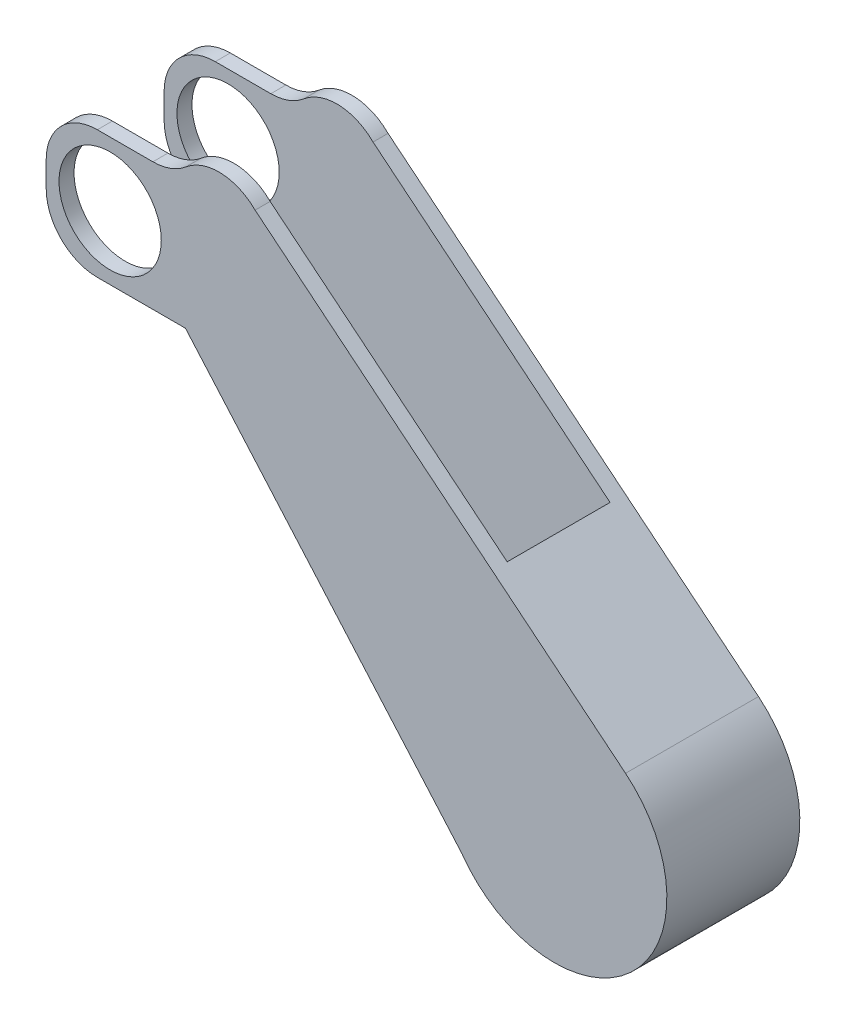
from build123d import *

# Parameters (mm, degrees)
EXTRUDE_1_DEPTH      = 26
SKETCH_4_R           = 9.996910884
CUT_EXTRUDE_2_DEPTH  = 26
FILLET_1_R           = 10
FILLET_2_R           = 10
CUT_EXTRUDE_4_DEPTH  = 26
SKETCH_8_R           = 13.6
CUT_EXTRUDE_5_DEPTH  = 20.12
EXTRUDE_2_DEPTH      = 26
FILLET_3_R           = 3
CUT_EXTRUDE_6_DEPTH  = 30
FILLET_9_R           = 10
FILLET_10_R          = 3
FILLET_11_R          = 10
CUT_EXTRUDE_7_DEPTH  = 30
SKETCH_13_W          = 20.118493956
SKETCH_13_H          = 70
CUT_EXTRUDE_8_DEPTH  = 44.75
CUT_EXTRUDE_9_DEPTH  = 44.75
SKETCH_15_R          = 22
EXTRUDE_3_DEPTH      = 26
EXTRUDE_4_REACH      = 99.657
CUT_EXTRUDE_13_DEPTH = 20
EXTRUDE_START        = -2.941506044
EXTRUDE_5_DEPTH      = 2.941506044
EXTRUDE_6_DEPTH      = 2.94


with BuildPart() as part:
    # 草图1 → 凸台-拉伸1 (new body)
    with BuildSketch(Plane.XY):
        Polygon((0, 0), (60.004097951, 0), (60.004097951, 25.002996284), (-59.998288516, 25.002996284), (-59.998288516, 0), align=None)
    extrude(amount=EXTRUDE_1_DEPTH)

    # 草图4 → 切除-拉伸2 (cut)
    with BuildSketch(Plane.XY.offset(26)):
        with Locations((-47.497668288, 12.501498142)):
            Circle(SKETCH_4_R)
    extrude(amount=-CUT_EXTRUDE_2_DEPTH, mode=Mode.SUBTRACT)

    # 圆角1
    fillet_1_edges = [part.edges().sort_by_distance(p)[0] for p in [
        (-59.998288516, 25.002996284, 13),
    ]]
    fillet(fillet_1_edges, radius=FILLET_1_R)

    # 圆角2
    fillet_2_edges = [part.edges().sort_by_distance(p)[0] for p in [
        (-59.998288516, 0, 13),
    ]]
    fillet(fillet_2_edges, radius=FILLET_2_R)

    # 草图7 → 切除-拉伸4 (cut)
    with BuildSketch(Plane(origin=(0, 25.002996284, 0), x_dir=(1, 0, 0), z_dir=(0, 1, 0))):
        Polygon((-37.501471928, -23.058493956), (-36.401101967, -23.058493956), (-36.401101967, -2.94), (-37.501471928, -2.94), (-62.053584156, -2.94), (-62.053584156, -23.058493956), align=None)
    extrude(amount=-CUT_EXTRUDE_4_DEPTH, mode=Mode.SUBTRACT)

    # 草图8 → 切除-拉伸5 (cut)
    with BuildSketch(Plane.XY.offset(2.94)):
        with Locations((-47.497668288, 12.501498142)):
            Circle(SKETCH_8_R)
    extrude(amount=CUT_EXTRUDE_5_DEPTH, mode=Mode.SUBTRACT)

    # 草图9 → 凸台-拉伸2 (add)
    with BuildSketch(Plane.XY.offset(26)):
        Polygon((-34.9988745, 25.002996284), (-22.500080712, 12.501498142), (-27.68722448, 0), (39.366276038, -67.053500518), (48.202948014, -58.216828542), (57.0397416, -49.380034956), (-17.34328964, 25.002996284), (-26.17108207, 33.830788714), align=None)
    extrude(amount=-EXTRUDE_2_DEPTH)

    # 圆角3
    fillet_3_edges = [part.edges().sort_by_distance(p)[0] for p in [
        (-36.401101967, 0, 12.999246978),
        (-36.401101967, 20.36446297, 12.999246978),
        (-36.401101967, 4.638533314, 12.999246978),
    ]]
    fillet(fillet_3_edges, radius=FILLET_3_R)

    # 草图10 → 切除-拉伸6 (cut)
    with BuildSketch(Plane.XY.offset(26)):
        Polygon((7.659706645, 0), (60.004097951, 0), (60.004097951, 25.002996284), (-17.34328964, 25.002996284), align=None)
    extrude(amount=-CUT_EXTRUDE_6_DEPTH, mode=Mode.SUBTRACT)

    # 圆角9
    # the kernel refuses this fillet: 10 mm, written as the material it adds along each edge
    with BuildSketch(Plane(origin=(-34.9988745, 25.002996284, 26), x_dir=(-1, 0, 0), z_dir=(0, 0, -1))) as fillet_9_piece_1_section:
        with BuildLine():
            CenterArc((FILLET_9_R * 0.414213562373, FILLET_9_R), FILLET_9_R, 225, 45)
            Line((-FILLET_9_R * 0.292893218813, FILLET_9_R * 0.292893218813), (0, 0))
            Line((0, 0), (FILLET_9_R * 0.414213562373, 0))
        make_face()
    fillet_9_piece_1 = extrude(amount=26, mode=Mode.PRIVATE)
    fillet_9_piece_1 = split(fillet_9_piece_1, bisect_by=Plane(origin=(-36.401101967, 24.986097048, 24.529246978), z_dir=(-1, 0, 0)), keep=Keep.TOP, mode=Mode.PRIVATE)
    fillet_9_piece_1 = split(fillet_9_piece_1, bisect_by=Plane(origin=(-37.504554949, 24.986097048, 23.058493956), z_dir=(0, 0, 1)), keep=Keep.TOP, mode=Mode.PRIVATE)
    add(fillet_9_piece_1)
    with BuildSketch(Plane(origin=(-34.9988745, 25.002996284, 26), x_dir=(-1, 0, 0), z_dir=(0, 0, -1))) as fillet_9_piece_2_section:
        with BuildLine():
            CenterArc((FILLET_9_R * 0.414213562373, FILLET_9_R), FILLET_9_R, 225, 45)
            Line((-FILLET_9_R * 0.292893218813, FILLET_9_R * 0.292893218813), (0, 0))
            Line((0, 0), (FILLET_9_R * 0.414213562373, 0))
        make_face()
    fillet_9_piece_2 = extrude(amount=26, mode=Mode.PRIVATE)
    fillet_9_piece_2 = split(fillet_9_piece_2, bisect_by=Plane(origin=(-36.401101967, 25.815006688, 24.529246978), z_dir=(1, 0, 0)), keep=Keep.TOP, mode=Mode.PRIVATE)
    fillet_9_piece_2 = split(fillet_9_piece_2, bisect_by=Plane(origin=(-34.567927652, 25.815006688, 23.058493956), z_dir=(0, 0, 1)), keep=Keep.TOP, mode=Mode.PRIVATE)
    add(fillet_9_piece_2)
    with BuildSketch(Plane(origin=(-34.9988745, 25.002996284, 26), x_dir=(-1, 0, 0), z_dir=(0, 0, -1))) as fillet_9_piece_3_section:
        with BuildLine():
            CenterArc((FILLET_9_R * 0.414213562373, FILLET_9_R), FILLET_9_R, 225, 45)
            Line((-FILLET_9_R * 0.292893218813, FILLET_9_R * 0.292893218813), (0, 0))
            Line((0, 0), (FILLET_9_R * 0.414213562373, 0))
        make_face()
    fillet_9_piece_3 = extrude(amount=26, mode=Mode.PRIVATE)
    fillet_9_piece_3 = split(fillet_9_piece_3, bisect_by=Plane(origin=(-34.567927652, 25.815006688, 2.94), z_dir=(0, 0, 1)), keep=Keep.TOP, mode=Mode.PRIVATE)
    fillet_9_piece_3 = split(fillet_9_piece_3, bisect_by=Plane(origin=(-36.401101967, 25.815006688, 12.999246978), z_dir=(1, 0, 0)), keep=Keep.TOP, mode=Mode.PRIVATE)
    fillet_9_piece_3 = split(fillet_9_piece_3, bisect_by=Plane(origin=(-34.567927652, 25.815006688, 23.058493956), z_dir=(0, 0, -1)), keep=Keep.TOP, mode=Mode.PRIVATE)
    add(fillet_9_piece_3)
    with BuildSketch(Plane(origin=(-34.9988745, 25.002996284, 26), x_dir=(-1, 0, 0), z_dir=(0, 0, -1))) as fillet_9_piece_4_section:
        with BuildLine():
            CenterArc((FILLET_9_R * 0.414213562373, FILLET_9_R), FILLET_9_R, 225, 45)
            Line((-FILLET_9_R * 0.292893218813, FILLET_9_R * 0.292893218813), (0, 0))
            Line((0, 0), (FILLET_9_R * 0.414213562373, 0))
        make_face()
    fillet_9_piece_4 = extrude(amount=26, mode=Mode.PRIVATE)
    fillet_9_piece_4 = split(fillet_9_piece_4, bisect_by=Plane(origin=(-37.504554949, 24.986097048, 2.94), z_dir=(0, 0, -1)), keep=Keep.TOP, mode=Mode.PRIVATE)
    fillet_9_piece_4 = split(fillet_9_piece_4, bisect_by=Plane(origin=(-36.401101967, 24.986097048, 1.47), z_dir=(-1, 0, 0)), keep=Keep.TOP, mode=Mode.PRIVATE)
    add(fillet_9_piece_4)
    with BuildSketch(Plane(origin=(-34.9988745, 25.002996284, 26), x_dir=(-1, 0, 0), z_dir=(0, 0, -1))) as fillet_9_piece_5_section:
        with BuildLine():
            CenterArc((FILLET_9_R * 0.414213562373, FILLET_9_R), FILLET_9_R, 225, 45)
            Line((-FILLET_9_R * 0.292893218813, FILLET_9_R * 0.292893218813), (0, 0))
            Line((0, 0), (FILLET_9_R * 0.414213562373, 0))
        make_face()
    fillet_9_piece_5 = extrude(amount=26, mode=Mode.PRIVATE)
    fillet_9_piece_5 = split(fillet_9_piece_5, bisect_by=Plane(origin=(-34.567927652, 25.815006688, 2.94), z_dir=(0, 0, -1)), keep=Keep.TOP, mode=Mode.PRIVATE)
    fillet_9_piece_5 = split(fillet_9_piece_5, bisect_by=Plane(origin=(-36.401101967, 25.815006688, 1.47), z_dir=(1, 0, 0)), keep=Keep.TOP, mode=Mode.PRIVATE)
    add(fillet_9_piece_5)

    # 圆角10
    fillet_10_edges = [part.edges().sort_by_distance(p)[0] for p in [
        (-36.401101967, 25.385673201, 12.999246978),
    ]]
    fillet(fillet_10_edges, radius=FILLET_10_R)

    # 圆角11
    fillet_11_edges = [part.edges().sort_by_distance(p)[0] for p in [
        (-26.17108207, 33.830788714, 13),
    ]]
    fillet(fillet_11_edges, radius=FILLET_11_R)

    # 草图12 → 切除-拉伸7 (cut)
    with BuildSketch(Plane(origin=(3.829853322, 3.829853322, 0), x_dir=(0, 0, -1), z_dir=(0.7071067811865404, 0.7071067811865547, 0))):
        Polygon((-12.999246978, 43.121170069), (-9.998089183, 43.121170069), (-9.998089183, 23.118852005), (-15.995491838, 23.118852005), (-15.995491838, 43.121170069), align=None)
    extrude(amount=-CUT_EXTRUDE_7_DEPTH, mode=Mode.SUBTRACT)

    # 草图13 → 切除-拉伸8 (cut, symmetric)
    with BuildSketch(Plane(origin=(3.829853322, 3.829853322, 0), x_dir=(0, 0, -1), z_dir=(0.7071067811865404, 0.7071067811865547, 0))):
        with Locations((-12.999246978, 7.961145372)):
            Rectangle(SKETCH_13_W, SKETCH_13_H)
    extrude(amount=CUT_EXTRUDE_8_DEPTH, both=True, mode=Mode.SUBTRACT)

    # 草图14 → 切除-拉伸9 (cut, symmetric)
    with BuildSketch(Plane(origin=(3.829853322, 3.829853322, 0), x_dir=(0, 0, -1), z_dir=(0.7071067811865404, 0.7071067811865547, 0))):
        Polygon((-23.06, 55.962849268), (-23.058493956, 36.05981453), (-2.94, 36.05981453), (-2.94, 55.962849268), align=None)
    extrude(amount=CUT_EXTRUDE_9_DEPTH, both=True, mode=Mode.SUBTRACT)

    # 草图15 → 凸台-拉伸3 (add)
    with BuildSketch(Plane(origin=(0, 0, 0), x_dir=(-1, 0, 0), z_dir=(0, 0, -1))):
        with Locations((-39.366276038, -49.380034956)):
            Circle(SKETCH_15_R)
    extrude(amount=-EXTRUDE_3_DEPTH)

    # 凸台-拉伸4: up to this face of the body (flat: up to its plane)
    extrude_4_end = Plane(part.part.faces().sort_by_distance((10.252727371, -21.880412524, 0))[0])
    # 草图16 → 凸台-拉伸4 (add, up to the picked face)
    with BuildSketch(Plane.XY.offset(26), mode=Mode.PRIVATE) as extrude_4_sk1:
        with BuildLine():
            Line((53.281607925, -32.339978076), (-19.148678719, 26.808385364))
            Line((-19.148678719, 26.808385364), (35.400190623, -27.740483979))
            ThreePointArc((35.400190623, -27.740483979), (44.846760764, -28.073597263), (53.281607925, -32.339978076))
        make_face()
    extrude_4_tool1 = split(extrude(extrude_4_sk1.sketch, amount=-EXTRUDE_4_REACH, mode=Mode.PRIVATE), bisect_by=extrude_4_end, keep=Keep.BOTH, mode=Mode.PRIVATE)
    add(extrude_4_tool1.solids().sort_by(Axis((21.577836, -9.730931, 26), (0, 0, -1)))[0])

    # 草图17 → 切除-拉伸13 (cut)
    with BuildSketch(Plane(origin=(3.829853322, 3.829853322, 0), x_dir=(0, 0, 1), z_dir=(-0.7071067811865404, -0.7071067811865548, 0))):
        Polygon((23.058493956, 32.496551656), (23.058493956, -27.038854628), (2.94, -27.038854628), (2.94, 32.428906565), (2.94, 35.354128857), (23.06, 35.354128857), align=None)
    extrude(amount=-CUT_EXTRUDE_13_DEPTH, mode=Mode.SUBTRACT)

    # 草图19 → 凸台-拉伸5 (add)
    with BuildSketch(Plane.XY.offset(26).offset(EXTRUDE_START)):
        with BuildLine():
            Line((-32.763505202, 0), (-27.68722448, 0))
            Line((-27.68722448, 0), (17.726725061, -45.413949541))
            ThreePointArc((17.726725061, -45.413949541), (17.874446419, -54.081232636), (21.358890569, -62.018629363))
            Line((21.358890569, -62.018629363), (-32.763505202, 0))
        make_face()
    extrude(amount=EXTRUDE_5_DEPTH)

    # 草图20 → 凸台-拉伸6 (add)
    with BuildSketch(Plane(origin=(0, 0, 0), x_dir=(-1, 0, 0), z_dir=(0, 0, -1))):
        with BuildLine():
            Line((-17.726725061, -45.413949541), (27.68722448, 0))
            Line((27.68722448, 0), (32.763505202, 0))
            Line((32.763505202, 0), (-21.358890569, -62.018629363))
            ThreePointArc((-21.358890569, -62.018629363), (-17.874446419, -54.081232636), (-17.726725061, -45.413949541))
        make_face()
    extrude(amount=-EXTRUDE_6_DEPTH)


solid = part.part
